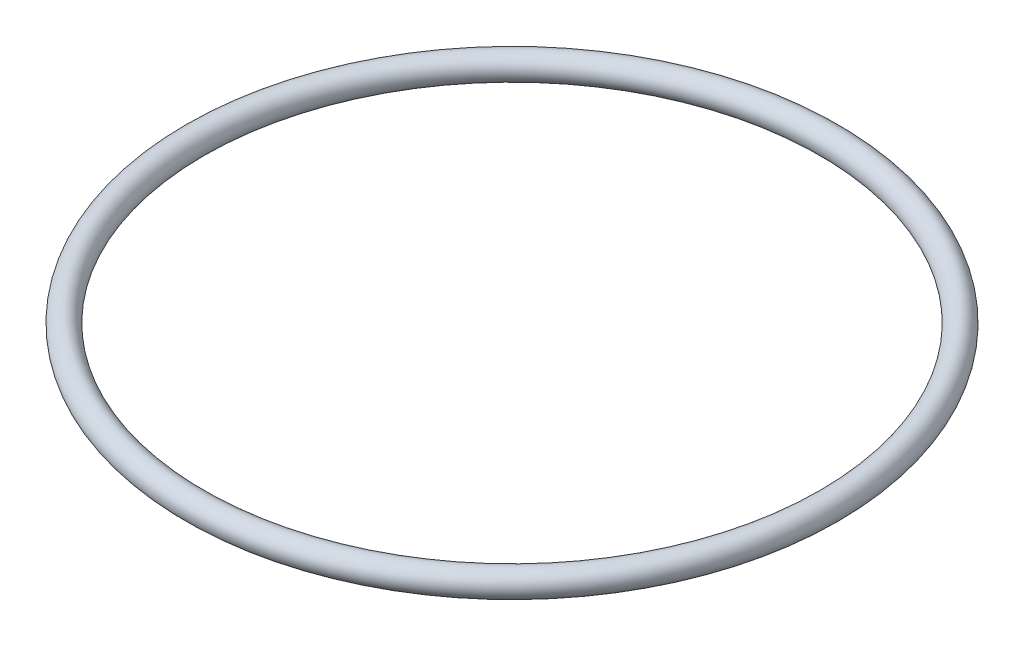
from build123d import *

# Parameters (mm, degrees)
SKETCH1_R = 0.5


with BuildPart() as part:
    # Sketch1 → Revolve1 (revolve)
    with BuildSketch(Plane.XY):
        with Locations((12.5, 0)):
            Circle(SKETCH1_R)
    revolve(axis=Axis((0, 46.363035352, 0), (0, -1, 0)))


solid = part.part
